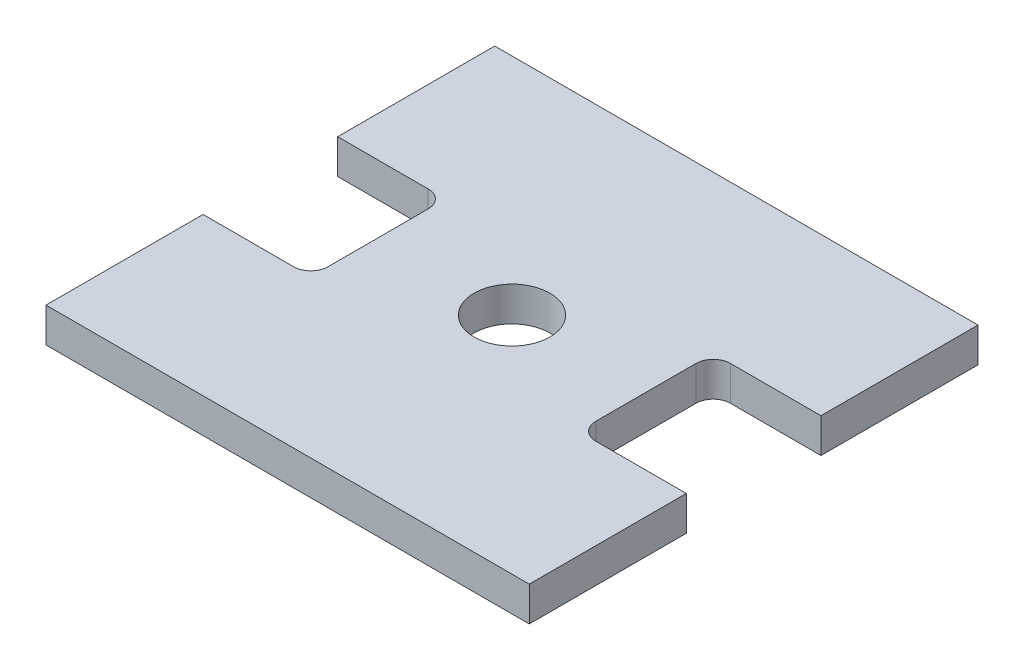
from build123d import *

# Parameters (mm, degrees)
SKETCH_1_R      = 11
EXTRUDE_1_DEPTH = 10


with BuildPart() as part:
    # Эскиз1 → Вытянуть1 (new body)
    with BuildSketch(Plane(origin=(0, 0, 0), x_dir=(1, 0, 0), z_dir=(0, 1, 0))):
        with BuildLine():
            Line((-34.176272466, 48.057375978), (105.823727534, 48.057375978))
            Line((105.823727534, 48.057375978), (105.823727534, 2.562145774))
            Line((105.823727534, 2.562145774), (79.601322316, 2.562145774))
            ThreePointArc((79.601322316, 2.562145774), (76.06578841, 1.09767968), (74.601322316, -2.437854226))
            Line((74.601322316, -2.437854226), (74.601322316, -31.447393818))
            ThreePointArc((74.601322316, -31.447393818), (76.06578841, -34.982927724), (79.601322316, -36.447393818))
            Line((79.601322316, -36.447393818), (105.823727534, -36.447393818))
            Line((105.823727534, -36.447393818), (105.823727534, -81.942624022))
            Line((105.823727534, -81.942624022), (-34.176272466, -81.942624022))
            Line((-34.176272466, -81.942624022), (-34.176272466, -36.447393818))
            Line((-34.176272466, -36.447393818), (-7.953867248, -36.447393818))
            ThreePointArc((-7.953867248, -36.447393818), (-4.418333342, -34.982927724), (-2.953867248, -31.447393818))
            Line((-2.953867248, -31.447393818), (-2.953867248, -2.437854226))
            ThreePointArc((-2.953867248, -2.437854226), (-4.418333342, 1.09767968), (-7.953867248, 2.562145774))
            Line((-7.953867248, 2.562145774), (-34.176272466, 2.562145774))
            Line((-34.176272466, 2.562145774), (-34.176272466, 48.057375978))
        make_face()
        with Locations((35.823727534, -16.942624022)):
            Circle(SKETCH_1_R, mode=Mode.SUBTRACT)
    extrude(amount=EXTRUDE_1_DEPTH)


solid = part.part
